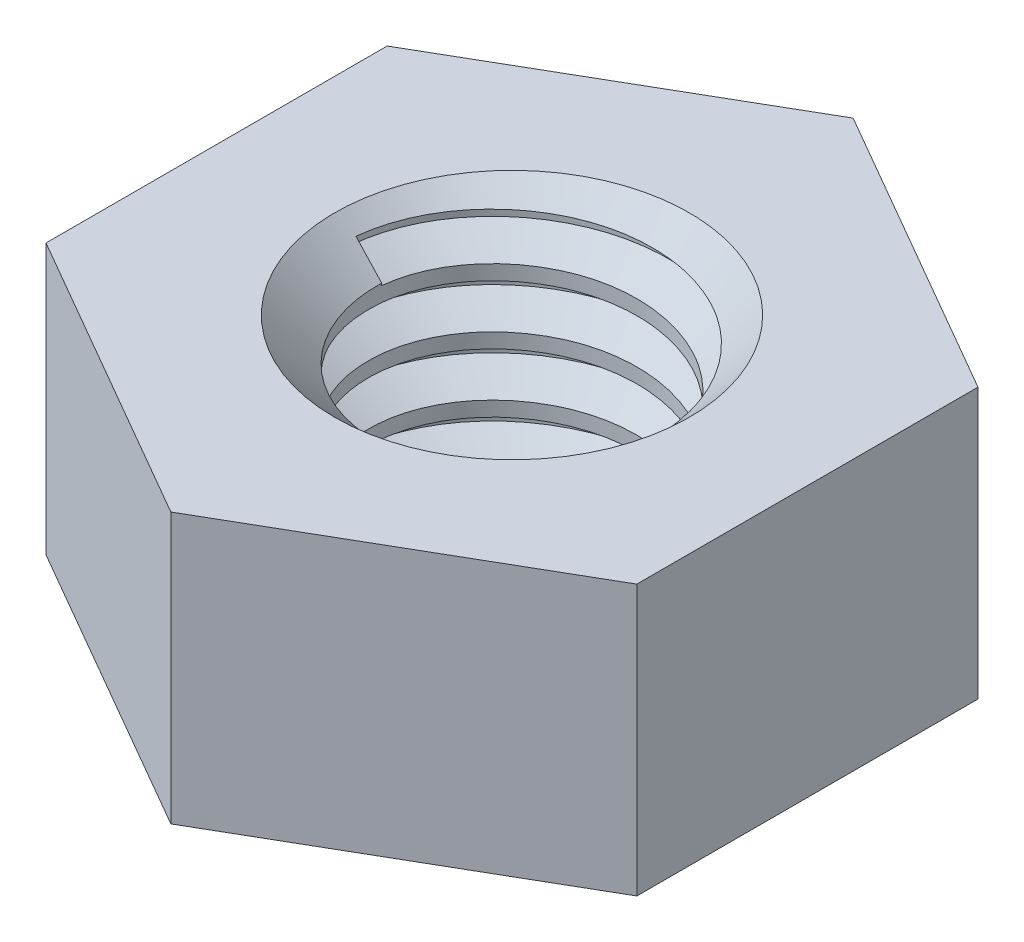
from build123d import *

# Parameters (mm, degrees)
BOSS_EXTRUDE1_DEPTH = 3.2
SKETCH2_R           = 1.6
CUT_EXTRUDE1_DEPTH  = 3.2
CHAMFER1_SIZE       = 0.5
THREAD1_PITCH       = 0.7


with BuildPart() as part:
    # Sketch1 → Boss-Extrude1 (new body)
    with BuildSketch(Plane(origin=(0, 0, 0), x_dir=(1, 0, 0), z_dir=(0, 1, 0))):
        Polygon((0, 4.041451884), (-3.5, 2.020725942), (-3.5, -2.020725942), (0, -4.041451884), (3.5, -2.020725942), (3.5, 2.020725942), align=None)
    extrude(amount=BOSS_EXTRUDE1_DEPTH)

    # Sketch2 → Cut-Extrude1 (cut)
    with BuildSketch(Plane(origin=(0, 3.2, 0), x_dir=(1, 0, 0), z_dir=(0, 1, 0))):
        with Locations(Location((0, 0, 0), (0, 0, 270))):
            Circle(SKETCH2_R)
    extrude(amount=-CUT_EXTRUDE1_DEPTH, mode=Mode.SUBTRACT)

    # Chamfer1
    chamfer1_edges = [part.edges().sort_by_distance(p)[0] for p in [
        (0, 0, -1.6),
        (0, 3.2, -1.6),
    ]]
    chamfer(chamfer1_edges, length=CHAMFER1_SIZE)

    # Thread1: the profile of Thread Profile1 profile screwed along a right-hand helix of 4.571429 turns, 6 arcs to a turn; built about Z, then put on its axis
    thread1_z = Axis((0, 0, 0), (0, 0, 1))
    thread1_corners = [(1.5997, 0, -0.000173205), (1.978886113, -1e-09, 0.218749999), (1.978886113, -1e-09, 0.306249999), (1.5997, 0, 0.525173203)]
    with BuildLine(mode=Mode.PRIVATE) as thread1_profile:
        Line(thread1_corners[0], thread1_corners[1])
        Line(thread1_corners[1], thread1_corners[2])
        Line(thread1_corners[2], thread1_corners[3])
        Line(thread1_corners[3], thread1_corners[0])
    thread1_cap = Face(thread1_profile.wire())
    thread1_turn_angles = [0, 30, 60, 90, 120, 150, 180, 210, 240, 270, 300, 330, 360]
    thread1_turn_weights = [1, 0.8660254037844387, 1, 0.8660254037844387, 1, 0.8660254037844387, 1, 0.8660254037844387, 1, 0.8660254037844387, 1, 0.8660254037844387, 1]
    thread1_turn_rails = [Edge.make_bspline([Vector(p[0], p[1], 0).rotate(thread1_z, thread1_turn_angles[k]) / thread1_turn_weights[k] + Vector(0, 0, p[2] + THREAD1_PITCH * thread1_turn_angles[k] / 360) for k in range(13)], [0, 0, 0, 1, 1, 2, 2, 3, 3, 4, 4, 5, 5, 6, 6, 6], 2, thread1_turn_weights) for p in thread1_corners]
    thread1_turn_sides = [Face.make_surface_from_curves(thread1_turn_rails[p[0]], thread1_turn_rails[p[1]]) for p in [(0, 1), (1, 2), (2, 3), (3, 0)]]
    thread1_last_angles = [1440, 1470, 1500, 1530, 1560, 1590, 1620, 1632.857142857, 1645.714285714]
    thread1_last_weights = [1, 0.8660254037844387, 1, 0.8660254037844387, 1, 0.8660254037844387, 1, 0.9749279121818266, 1]
    thread1_last_rails = [Edge.make_bspline([Vector(p[0], p[1], 0).rotate(thread1_z, thread1_last_angles[k]) / thread1_last_weights[k] + Vector(0, 0, p[2] + THREAD1_PITCH * thread1_last_angles[k] / 360) for k in range(9)], [0, 0, 0, 1, 1, 2, 2, 3, 3, 4, 4, 4], 2, thread1_last_weights) for p in thread1_corners]
    thread1_last_sides = [Face.make_surface_from_curves(thread1_last_rails[p[0]], thread1_last_rails[p[1]]) for p in [(0, 1), (1, 2), (2, 3), (3, 0)]]
    thread1 = Plane(origin=(0, 3.2, 0), x_dir=(-0.999390827, 0, -0.034899497), z_dir=(0, -1, 0)) * Solid(Shell([*[p.moved(Location((0, 0, THREAD1_PITCH * i))) for i in range(4) for p in thread1_turn_sides], *thread1_last_sides, thread1_cap, thread1_cap.rotate(thread1_z, 1645.714285714).moved(Location((0, 0, THREAD1_PITCH * 1645.714285714 / 360)))]))
    add(thread1, mode=Mode.SUBTRACT)


solid = part.part
